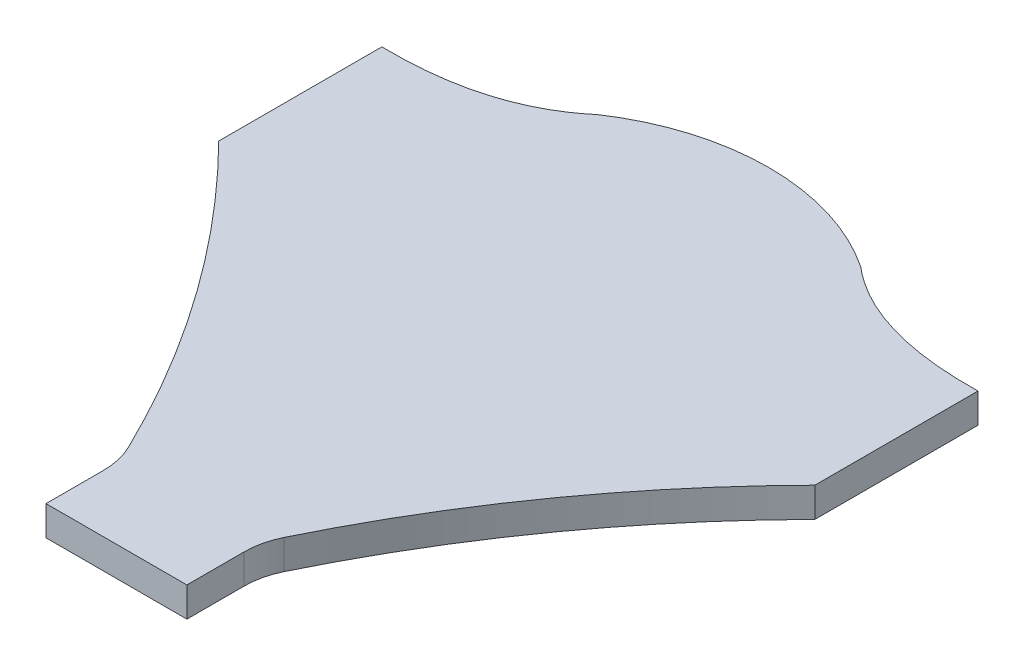
from build123d import *

# Parameters (mm, degrees)
BOSS_EXTRUDE1_DEPTH = 5.08
FILLET1_R           = 12.7
FILLET2_R           = 12.7


with BuildPart() as part:
    # Sketch1 → Boss-Extrude1 (new body)
    with BuildSketch(Plane(origin=(0, 0, 0), x_dir=(1, 0, 0), z_dir=(0, 1, 0))):
        with BuildLine():
            Line((51.054, -2.54), (51.054, 0))
            Line((51.054, 0), (51.054, 25.4))
            add(Edge.make_bspline(
                [(51.054, 25.4), (35.593374206, 25.086699202), (25.873960254, 31.339237081)],
                knots=[0, 0, 0, 0.413959763, 0.413959763, 0.413959763], degree=2))
            add(Edge.make_bspline(
                [(25.873960254, 31.339237081), (24.125496917, 32.46403054), (22.562829629, 33.80130647)],
                knots=[0.413959763, 0.413959763, 0.413959763, 0.488428602, 0.488428602, 0.488428602], degree=2))
            ThreePointArc((22.562829629, 33.80130647), (0, 40.64), (-22.562829629, 33.80130647))
            add(Edge.make_bspline(
                [(-25.873960254, 31.339237081), (-24.125496917, 32.46403054), (-22.562829629, 33.80130647)],
                knots=[0.413959763, 0.413959763, 0.413959763, 0.488428602, 0.488428602, 0.488428602], degree=2))
            add(Edge.make_bspline(
                [(-51.054, 25.4), (-35.593374206, 25.086699202), (-25.873960254, 31.339237081)],
                knots=[0, 0, 0, 0.413959763, 0.413959763, 0.413959763], degree=2))
            Line((-51.054, 25.4), (-51.054, 0))
            Line((-51.054, 0), (-51.054, -2.54))
            add(Edge.make_bspline(
                [(-51.054, -2.54), (-42.130232366, -11.547896864), (-34.503914612, -21.472994119)],
                knots=[0, 0, 0, 0.367111941, 0.367111941, 0.367111941], degree=2))
            add(Edge.make_bspline(
                [(-34.503914612, -21.472994119), (-32.482868864, -24.103237999), (-30.552942986, -26.797896838)],
                knots=[0.367111941, 0.367111941, 0.367111941, 0.46440005, 0.46440005, 0.46440005], degree=2))
            add(Edge.make_bspline(
                [(-30.552942986, -26.797896838), (-19.928127461, -41.632794577), (-12.065, -58.42)],
                knots=[0.46440005, 0.46440005, 0.46440005, 1, 1, 1], degree=2))
            Line((-12.065, -58.42), (-12.065, -71.12))
            Line((-12.065, -71.12), (12.065, -71.12))
            Line((12.065, -71.12), (12.065, -58.42))
            add(Edge.make_bspline(
                [(30.552942986, -26.797896838), (19.928127461, -41.632794577), (12.065, -58.42)],
                knots=[0.46440005, 0.46440005, 0.46440005, 1, 1, 1], degree=2))
            add(Edge.make_bspline(
                [(34.503914612, -21.472994119), (32.482868864, -24.103237999), (30.552942986, -26.797896838)],
                knots=[0.367111941, 0.367111941, 0.367111941, 0.46440005, 0.46440005, 0.46440005], degree=2))
            add(Edge.make_bspline(
                [(51.054, -2.54), (42.130232366, -11.547896864), (34.503914612, -21.472994119)],
                knots=[0, 0, 0, 0.367111941, 0.367111941, 0.367111941], degree=2))
        make_face()
    extrude(amount=BOSS_EXTRUDE1_DEPTH)

    # Fillet1
    fillet1_edges = [part.edges().sort_by_distance(p)[0] for p in [
        (-12.065, 2.54, 58.42),
    ]]
    fillet(fillet1_edges, radius=FILLET1_R)

    # Fillet2
    fillet2_edges = [part.edges().sort_by_distance(p)[0] for p in [
        (12.065, 2.54, 58.42),
    ]]
    fillet(fillet2_edges, radius=FILLET2_R)


solid = part.part
